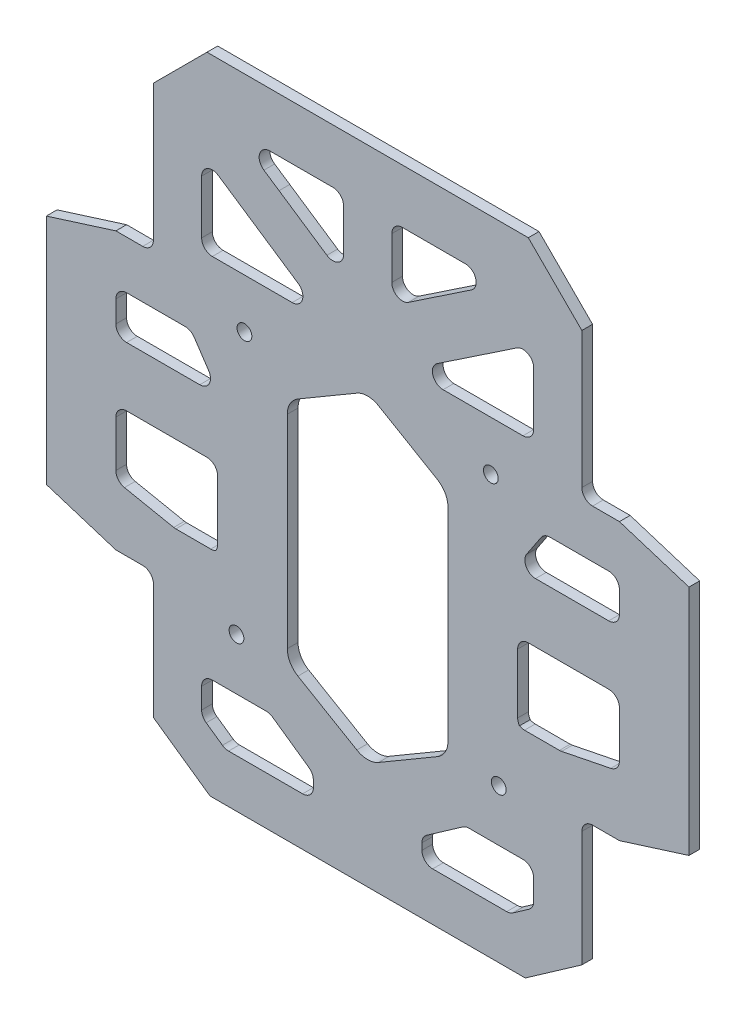
from build123d import *

# Parameters (mm, degrees)
BOSS_EXTRUDE1_DEPTH      = 1.27
CUT_EXTRUDE2_DEPTH       = 118.115761535
CUT_EXTRUDE2_DEPTH_BACK  = 118.115761535
FILLET2_R                = 3.81
FILLET3_R                = 2.54
FILLET5_R                = 5.08
FILLET7_R                = 5.08
FILLET8_R                = 2.54
FILLET10_R               = 2.54
FILLET11_R               = 2.54
CUT_EXTRUDE4_DEPTH       = 118.115761535
CUT_EXTRUDE4_DEPTH_BACK  = 118.115761535
SKETCH3_R                = 1.75
CUT_EXTRUDE5_DEPTH       = 118.115761535
CUT_EXTRUDE5_DEPTH_BACK  = 118.115761535
CUT_EXTRUDE9_DEPTH       = 118.115761535
CUT_EXTRUDE9_DEPTH_BACK  = 118.115761535
SKETCH9_W                = 24.13
SKETCH9_H                = 10.16
BOSS_EXTRUDE4_DEPTH      = 2.54
CUT_EXTRUDE10_DEPTH      = 118.115761535
CUT_EXTRUDE10_DEPTH_BACK = 118.115761535
FILLET12_R               = 2.54
SKETCH12_W               = 24.13
SKETCH12_H               = 3.885775835
BOSS_EXTRUDE5_DEPTH      = 2.54
FILLET13_START           = -1.27
FILLET13_DEPTH           = 2.54
CUT_EXTRUDE11_DEPTH      = 118.115761535
BOSS_EXTRUDE6_DEPTH      = 2.54
BOSS_EXTRUDE7_DEPTH      = 2.54
FILLET15_R               = 2.54
CUT_EXTRUDE12_DEPTH      = 118.115761535
CUT_EXTRUDE13_DEPTH      = 118.115761535
BOSS_EXTRUDE8_DEPTH      = 2.54
SKETCH19_W               = 17.827282033
SKETCH19_H               = 11.43
SKETCH19_W_2             = 11.43
SKETCH19_H_2             = 23.699755781
BOSS_EXTRUDE9_DEPTH      = 2.54
CUT_EXTRUDE14_DEPTH      = 118.115761535
BOSS_EXTRUDE11_DEPTH     = 2.54
BOSS_EXTRUDE13_DEPTH     = 2.54
FILLET16_R               = 2.54
FILLET17_R               = 2.54


with BuildPart() as part:
    # Sketch1 → Boss-Extrude1 (new, symmetric)
    with BuildSketch(Plane.XY):
        Polygon((-76.2, 63.5), (-76.2, -63.5), (76.2, -63.5), (76.2, 63.5), (50.8, 88.9), (-50.8, 88.9), align=None)
    extrude(amount=BOSS_EXTRUDE1_DEPTH, both=True)

    # Sketch2 → Cut-Extrude2 (cut, two sides: drawn at the far end of the back side and taken through both)
    with BuildSketch(Plane.XY.offset(1.27).offset(-CUT_EXTRUDE2_DEPTH_BACK)):
        Polygon((-19.05, 26.9875), (-19.05, -26.9875), (0, -38.14122293), (19.05, -26.9875), (19.05, 26.9875), (0, 38.14122293), align=None)
        Polygon((35.578460557, -11.758335255), (45.548381436, -26.713216576), (59.708460557, -26.713216576), (59.708460557, 27.261783424), (40.076377223, 27.261783424), (35.578460557, 20.514908424), align=None)
        Polygon((59.708460557, -44.311621405), (48.628361261, -52.07), (12.873487357, -52.07), (12.873487357, -46.659917121), (23.222848295, -39.413216576), (59.708460557, -39.413216576), align=None)
        Polygon((76.2, -63.5), (76.2, -57.785), (68.038134141, -63.5), align=None)
        Polygon((9.5434533, 47.581783424), (59.708460557, 47.581783424), (59.708460557, 58.145792392), (46.553776688, 72.39), align=None)
        Polygon((-27.94, 73.66), (27.94, 73.66), (0, 54.931669492), align=None)
        Polygon((-76.2, -57.785), (-68.038134141, -63.5), (-76.2, -63.5), align=None)
        Polygon((-23.222848295, -39.413216576), (-59.708460557, -39.413216576), (-59.708460557, -44.311621405), (-48.628361261, -52.07), (-12.873487357, -52.07), (-12.873487357, -46.659917121), align=None)
        Polygon((-35.578460557, 20.514908424), (-40.076377223, 27.261783424), (-59.708460557, 27.261783424), (-59.708460557, -26.713216576), (-45.548381436, -26.713216576), (-35.578460557, -11.758335255), align=None)
        Polygon((-59.708460557, 58.145792392), (-46.553776688, 72.39), (-9.5434533, 47.581783424), (-59.708460557, 47.581783424), align=None)
    extrude(amount=CUT_EXTRUDE2_DEPTH + CUT_EXTRUDE2_DEPTH_BACK, mode=Mode.SUBTRACT)

    # Fillet2
    fillet2_edges = [part.edges().sort_by_distance(p)[0] for p in [
        (46.553776688, 72.39, 0),
        (59.708460557, 58.145792392, 0),
        (59.708460557, 47.581783424, 0),
        (-59.708460557, 47.581783424, 0),
        (-59.708460557, 58.145792392, 0),
        (-46.553776688, 72.39, 0),
        (0, 54.931669492, 0),
    ]]
    fillet(fillet2_edges, radius=FILLET2_R)

    # Fillet3
    fillet3_edges = [part.edges().sort_by_distance(p)[0] for p in [
        (9.5434533, 47.581783424, 0),
        (-9.5434533, 47.581783424, 0),
        (-27.94, 73.66, 0),
        (27.94, 73.66, 0),
    ]]
    fillet(fillet3_edges, radius=FILLET3_R)

    # Fillet5
    fillet5_edges = [part.edges().sort_by_distance(p)[0] for p in [
        (0, -38.14122293, 0),
        (0, 38.14122293, 0),
    ]]
    fillet(fillet5_edges, radius=FILLET5_R)

    # Fillet7
    fillet7_edges = [part.edges().sort_by_distance(p)[0] for p in [
        (19.05, -26.9875, 0),
        (-19.05, -26.9875, 0),
        (-19.05, 26.9875, 0),
        (19.05, 26.9875, 0),
    ]]
    fillet(fillet7_edges, radius=FILLET7_R)

    # Fillet8
    fillet8_edges = [part.edges().sort_by_distance(p)[0] for p in [
        (12.873487357, -52.07, 0),
        (23.222848295, -39.413216576, 0),
        (59.708460557, -39.413216576, 0),
        (48.628361261, -52.07, 0),
        (-23.222848295, -39.413216576, 0),
        (-12.873487357, -52.07, 0),
        (-48.628361261, -52.07, 0),
        (-59.708460557, -39.413216576, 0),
    ]]
    fillet(fillet8_edges, radius=FILLET8_R)

    # Fillet10
    fillet10_edges = [part.edges().sort_by_distance(p)[0] for p in [
        (12.873487357, -46.659917121, 0),
        (59.708460557, -44.311621405, 0),
        (-12.873487357, -46.659917121, 0),
        (-59.708460557, -44.311621405, 0),
    ]]
    fillet(fillet10_edges, radius=FILLET10_R)

    # Fillet11
    fillet11_edges = [part.edges().sort_by_distance(p)[0] for p in [
        (59.708460557, -26.713216576, 0),
        (45.548381436, -26.713216576, 0),
        (35.578460557, -11.758335255, 0),
        (35.578460557, 20.514908424, 0),
        (40.076377223, 27.261783424, 0),
        (59.708460557, 27.261783424, 0),
        (-35.578460557, 20.514908424, 0),
        (-35.578460557, -11.758335255, 0),
        (-45.548381436, -26.713216576, 0),
        (-59.708460557, -26.713216576, 0),
        (-59.708460557, 27.261783424, 0),
        (-40.076377223, 27.261783424, 0),
    ]]
    fillet(fillet11_edges, radius=FILLET11_R)

    # Sketch3 → Cut-Extrude4 (cut, two sides: drawn at the far end of the back side and taken through both)
    with BuildSketch(Plane(origin=(0, 0, -1.27), x_dir=(-1, 0, 0), z_dir=(0, 0, -1)).offset(-CUT_EXTRUDE4_DEPTH_BACK)):
        with Locations((31.100832091, -27.164313073)):
            Circle(SKETCH3_R)
        with Locations((29.215925728, 35.858350336)):
            Circle(SKETCH3_R)
        with Locations(Location((-31.100832091, -27.164313073, 0), (0, 0, 180))):
            Circle(SKETCH3_R)
        with Locations(Location((-29.215925728, 35.858350336, 0), (0, 0, 180))):
            Circle(SKETCH3_R)
    extrude(amount=CUT_EXTRUDE4_DEPTH + CUT_EXTRUDE4_DEPTH_BACK, mode=Mode.SUBTRACT)

    # Sketch4 → Cut-Extrude5 (cut, two sides: drawn at the far end of the back side and taken through both)
    with BuildSketch(Plane(origin=(0, 0, -1.27), x_dir=(-1, 0, 0), z_dir=(0, 0, -1)).offset(-CUT_EXTRUDE5_DEPTH_BACK)):
        Polygon((-76.2, -52.07), (-76.2, -57.785), (-68.038134141, -63.5), (-59.708460557, -63.5), align=None)
        Polygon((76.2, -52.07), (59.708460557, -63.5), (68.038134141, -63.5), (76.2, -57.785), align=None)
    extrude(amount=CUT_EXTRUDE5_DEPTH + CUT_EXTRUDE5_DEPTH_BACK, mode=Mode.SUBTRACT)

    # Sketch7 → Cut-Extrude9 (cut, two sides: drawn at the far end of the back side and taken through both)
    with BuildSketch(Plane(origin=(0, 0, -1.27), x_dir=(-1, 0, 0), z_dir=(0, 0, -1)).offset(-CUT_EXTRUDE9_DEPTH_BACK)):
        Polygon((59.708460557, 24.721783424), (39.322336222, 26.130721922), (47.469178522, 38.350985376), (59.708460557, 38.350985376), align=None)
        Polygon((-59.708460557, 38.350985376), (-59.708460557, 24.721783424), (-39.322336222, 26.130721922), (-47.469178522, 38.350985376), align=None)
    extrude(amount=CUT_EXTRUDE9_DEPTH + CUT_EXTRUDE9_DEPTH_BACK, mode=Mode.SUBTRACT)

    # Sketch9 → Boss-Extrude4 (add)
    with BuildSketch(Plane(origin=(0, 0, -1.27), x_dir=(-1, 0, 0), z_dir=(0, 0, -1))):
        with Locations((-47.643460557, 14.665858304)):
            Rectangle(SKETCH9_W, SKETCH9_H)
        with Locations((47.643460557, 14.665858304)):
            Rectangle(SKETCH9_W, SKETCH9_H)
    extrude(amount=-BOSS_EXTRUDE4_DEPTH)

    # Sketch11 → Cut-Extrude10 (cut, two sides: drawn at the far end of the back side and taken through both)
    with BuildSketch(Plane(origin=(0, 0, -1.27), x_dir=(-1, 0, 0), z_dir=(0, 0, -1)).offset(-CUT_EXTRUDE10_DEPTH_BACK)):
        Polygon((-21.00307482, 69.010142181), (-31.552363918, 76.081386735), (31.560640268, 76.069023948), (21.00307482, 69.010142181), align=None)
    extrude(amount=CUT_EXTRUDE10_DEPTH + CUT_EXTRUDE10_DEPTH_BACK, mode=Mode.SUBTRACT)

    # Fillet12
    fillet12_edges = [part.edges().sort_by_distance(p)[0] for p in [
        (31.552363918, 76.081386735, 0),
        (-31.560640268, 76.069023948, 0),
    ]]
    fillet(fillet12_edges, radius=FILLET12_R)

    # Sketch12 → Boss-Extrude5 (add)
    with BuildSketch(Plane(origin=(0, 0, -1.27), x_dir=(-1, 0, 0), z_dir=(0, 0, -1))):
        with Locations((47.643460557, 7.642970387)):
            Rectangle(SKETCH12_W, SKETCH12_H)
        with Locations((-47.643460557, 7.642970387)):
            Rectangle(SKETCH12_W, SKETCH12_H)
    extrude(amount=-BOSS_EXTRUDE5_DEPTH)

    # Fillet13: read off the stored shape, not the designer's step
    # Fillet13 outline → Fillet13 (add)
    with BuildSketch(Plane.XY.offset(FILLET13_START)):
        with BuildLine():
            ThreePointArc((57.168460557, 38.350985376), (58.964511781, 37.6070366), (59.708460557, 35.810985376))
            Line((59.708460557, 35.810985376), (59.708460557, 38.350985376))
            Line((59.708460557, 38.350985376), (57.168460557, 38.350985376))
        make_face()
        with BuildLine():
            Line((59.708460557, 19.745858304), (59.708460557, 22.285858304))
            ThreePointArc((59.708460557, 22.285858304), (58.964511781, 20.48980708), (57.168460557, 19.745858304))
            Line((57.168460557, 19.745858304), (59.708460557, 19.745858304))
        make_face()
        with BuildLine():
            ThreePointArc((46.715137521, 37.219923874), (47.630026138, 38.050438857), (48.828545269, 38.350985376))
            Line((48.828545269, 38.350985376), (47.469178522, 38.350985376))
            Line((47.469178522, 38.350985376), (46.715137521, 37.219923874))
        make_face()
        with BuildLine():
            Line((35.578460557, 19.745858304), (39.81179389, 19.745858304))
            ThreePointArc((39.81179389, 19.745858304), (37.572340409, 21.087339173), (37.698386142, 23.694796802))
            Line((37.698386142, 23.694796802), (36.005052809, 21.154796802))
            ThreePointArc((36.005052809, 21.154796802), (35.68744681, 20.481910041), (35.578460557, 19.745858304))
        make_face()
        with BuildLine():
            Line((59.708460557, 5.700082469), (57.168460557, 5.700082469))
            ThreePointArc((57.168460557, 5.700082469), (58.964511781, 4.956133693), (59.708460557, 3.160082469))
            Line((59.708460557, 3.160082469), (59.708460557, 5.700082469))
        make_face()
        with BuildLine():
            ThreePointArc((35.578460557, 3.160082469), (36.322409333, 4.956133693), (38.118460557, 5.700082469))
            Line((38.118460557, 5.700082469), (35.578460557, 5.700082469))
            Line((35.578460557, 5.700082469), (35.578460557, 3.160082469))
        make_face()
        with BuildLine():
            Line((-59.708460557, 38.350985376), (-59.708460557, 35.810985376))
            ThreePointArc((-59.708460557, 35.810985376), (-58.964511781, 37.6070366), (-57.168460557, 38.350985376))
            Line((-57.168460557, 38.350985376), (-59.708460557, 38.350985376))
        make_face()
        with BuildLine():
            ThreePointArc((-57.168460557, 19.745858304), (-58.964511781, 20.48980708), (-59.708460557, 22.285858304))
            Line((-59.708460557, 22.285858304), (-59.708460557, 19.745858304))
            Line((-59.708460557, 19.745858304), (-57.168460557, 19.745858304))
        make_face()
        with BuildLine():
            Line((-47.469178522, 38.350985376), (-48.828545269, 38.350985376))
            ThreePointArc((-48.828545269, 38.350985376), (-47.630026138, 38.050438857), (-46.715137521, 37.219923874))
            Line((-46.715137521, 37.219923874), (-47.469178522, 38.350985376))
        make_face()
        with BuildLine():
            ThreePointArc((-37.698386142, 23.694796802), (-37.572340409, 21.087339173), (-39.81179389, 19.745858304))
            Line((-39.81179389, 19.745858304), (-35.578460557, 19.745858304))
            ThreePointArc((-35.578460557, 19.745858304), (-35.68744681, 20.481910041), (-36.005052809, 21.154796802))
            Line((-36.005052809, 21.154796802), (-37.698386142, 23.694796802))
        make_face()
        with BuildLine():
            Line((-59.708460557, 5.700082469), (-59.708460557, 3.160082469))
            ThreePointArc((-59.708460557, 3.160082469), (-58.964511781, 4.956133693), (-57.168460557, 5.700082469))
            Line((-57.168460557, 5.700082469), (-59.708460557, 5.700082469))
        make_face()
        with BuildLine():
            Line((-35.578460557, 5.700082469), (-38.118460557, 5.700082469))
            ThreePointArc((-38.118460557, 5.700082469), (-36.322409333, 4.956133693), (-35.578460557, 3.160082469))
            Line((-35.578460557, 3.160082469), (-35.578460557, 5.700082469))
        make_face()
    extrude(amount=FILLET13_DEPTH)

    # Sketch13 → Cut-Extrude11 (cut, through all)
    with BuildSketch(Plane(origin=(0, 0, -1.27), x_dir=(-1, 0, 0), z_dir=(0, 0, -1))):
        Polygon((-50.8, 88.9), (-50.8, 38.350985376), (-76.2, 38.350985376), (-76.2, 63.5), align=None)
        Polygon((50.8, 88.9), (76.2, 63.5), (76.2, 38.350985376), (50.8, 38.350985376), align=None)
        Polygon((-50.8, -63.5), (-50.8, -12.950985274), (-76.2, -12.950985274), (-76.2, -52.07), (-59.708460557, -63.5), align=None)
        Polygon((76.2, -52.07), (59.708460557, -63.5), (50.8, -63.5), (50.8, -12.950985274), (76.2, -12.950985274), align=None)
    extrude(amount=-CUT_EXTRUDE11_DEPTH, mode=Mode.SUBTRACT)

    # Sketch14 → Boss-Extrude6 (add)
    with BuildSketch(Plane(origin=(0, 0, -1.27), x_dir=(-1, 0, 0), z_dir=(0, 0, -1))):
        Polygon((-43.810489913, -39.413216576), (-50.8, -39.413216576), (-50.8, -52.07), (-43.810489913, -52.07), (-43.810489913, -45.043392375), align=None)
        Polygon((-33.775454239, -52.07), (-43.810489913, -45.043392375), (-43.810489913, -52.07), align=None)
        Polygon((43.810489913, -45.043392375), (43.810489913, -52.07), (50.8, -52.07), (50.8, -39.413216576), (43.810489913, -39.413216576), align=None)
        Polygon((33.775454239, -52.07), (43.810489913, -52.07), (43.810489913, -45.043392375), align=None)
    extrude(amount=-BOSS_EXTRUDE6_DEPTH)

    # Sketch15 → Boss-Extrude7 (add)
    with BuildSketch(Plane(origin=(0, 0, -1.27), x_dir=(-1, 0, 0), z_dir=(0, 0, -1))):
        Polygon((-39.37, -39.413216576), (-39.37, -48.152656885), (-43.810489913, -45.043392375), (-43.810489913, -39.413216576), align=None)
        Polygon((43.810489913, -39.413216576), (43.810489913, -45.043392375), (39.37, -48.152656885), (39.37, -39.413216576), align=None)
    extrude(amount=-BOSS_EXTRUDE7_DEPTH)

    # Fillet15
    fillet15_edges = [part.edges().sort_by_distance(p)[0] for p in [
        (-33.775454239, -52.07, 0),
        (33.775454239, -52.07, 0),
        (39.37, -48.152656885, 0),
        (39.37, -39.413216576, 0),
        (-39.37, -48.152656885, 0),
        (-39.37, -39.413216576, 0),
    ]]
    fillet(fillet15_edges, radius=FILLET15_R)

    # Sketch16 → Cut-Extrude12 (cut, through all)
    with BuildSketch(Plane(origin=(0, 0, -1.27), x_dir=(-1, 0, 0), z_dir=(0, 0, -1))):
        Polygon((50.8, -54.102738273), (37.379319396, -63.5), (50.8, -63.5), align=None)
        Polygon((-50.8, -54.102738273), (-50.8, -63.5), (-37.379319396, -63.5), align=None)
    extrude(amount=-CUT_EXTRUDE12_DEPTH, mode=Mode.SUBTRACT)

    # Sketch17 → Cut-Extrude13 (cut, through all)
    with BuildSketch(Plane(origin=(0, 0, -1.27), x_dir=(-1, 0, 0), z_dir=(0, 0, -1))):
        Polygon((-76.2, -7.751222861), (-59.708460557, -12.950985274), (-76.2, -12.950985274), align=None)
        Polygon((76.2, -7.751222861), (76.2, -12.950985274), (59.708460557, -12.950985274), align=None)
        Polygon((76.2, 33.151222963), (59.708460557, 38.350985376), (76.2, 38.350985376), align=None)
        Polygon((-76.2, 33.151222963), (-76.2, 38.350985376), (-59.708460557, 38.350985376), align=None)
    extrude(amount=-CUT_EXTRUDE13_DEPTH, mode=Mode.SUBTRACT)

    # Sketch18 → Boss-Extrude8 (add)
    with BuildSketch(Plane(origin=(0, 0, -1.27), x_dir=(-1, 0, 0), z_dir=(0, 0, -1))):
        Polygon((-59.708460557, -12.950985274), (-59.708460557, -24.126985274), (-76.2, -18.927222861), (-76.2, -7.751222861), align=None)
        Polygon((-59.708460557, 38.350985376), (-59.708460557, 41.398985376), (-76.2, 36.199222963), (-76.2, 33.151222963), align=None)
        Polygon((76.2, -7.751222861), (76.2, -18.927222861), (59.708460557, -24.126985274), (59.708460557, -12.950985274), align=None)
        Polygon((59.708460557, 38.350985376), (59.708460557, 41.398985376), (76.2, 36.199222963), (76.2, 33.151222963), align=None)
    extrude(amount=-BOSS_EXTRUDE8_DEPTH)

    # Sketch19 → Boss-Extrude9 (add)
    with BuildSketch(Plane(origin=(0, 0, -1.27), x_dir=(-1, 0, 0), z_dir=(0, 0, -1))):
        Polygon((-59.708460557, -24.126985274), (-50.8, -24.126985274), (-50.8, -26.713216576), (-36.204227236, -26.713216576), (-36.204227236, -12.696985274), (-59.708460557, -12.696985274), align=None)
        with Locations((-50.794819541, 35.683985376)):
            Rectangle(SKETCH19_W, SKETCH19_H)
        with Locations((-45.085, 59.431661315)):
            Rectangle(SKETCH19_W_2, SKETCH19_H_2)
        Polygon((36.204227236, -12.696985274), (36.204227236, -26.713216576), (50.8, -26.713216576), (50.8, -24.126985274), (59.708460557, -24.126985274), (59.708460557, -12.696985274), align=None)
        with Locations((50.794819541, 35.683985376)):
            Rectangle(SKETCH19_W, SKETCH19_H)
        with Locations((45.085, 59.431661315)):
            Rectangle(SKETCH19_W_2, SKETCH19_H_2)
    extrude(amount=-BOSS_EXTRUDE9_DEPTH)

    # Sketch20 → Cut-Extrude14 (cut, through all)
    with BuildSketch(Plane(origin=(0, 0, -1.27), x_dir=(-1, 0, 0), z_dir=(0, 0, -1))):
        Polygon((50.8, 88.9), (50.8, 76.2), (38.1, 88.9), align=None)
        Polygon((-50.8, 88.9), (-50.8, 76.2), (-38.1, 88.9), align=None)
    extrude(amount=-CUT_EXTRUDE14_DEPTH, mode=Mode.SUBTRACT)

    # Sketch21 → Boss-Extrude11 (add)
    with BuildSketch(Plane(origin=(0, 0, -1.27), x_dir=(-1, 0, 0), z_dir=(0, 0, -1))):
        Polygon((-5.716720007, 54.486325962), (5.713279773, 54.486325962), (5.713279773, 76.074087016), (-5.716720007, 76.076325962), align=None)
    extrude(amount=-BOSS_EXTRUDE11_DEPTH)

    # Sketch22 → Boss-Extrude13 (add)
    with BuildSketch(Plane(origin=(0, 0, -1.27), x_dir=(-1, 0, 0), z_dir=(0, 0, -1))):
        Polygon((-45.738460557, -12.696985274), (-59.708460557, -9.88815845), (-59.708460557, -12.696985274), align=None)
        Polygon((59.708460557, -9.88815845), (59.708460557, -12.696985274), (45.738460557, -12.696985274), align=None)
    extrude(amount=-BOSS_EXTRUDE13_DEPTH)

    # Fillet16
    # the kernel refuses this fillet: 2.54 mm, written as the material it adds along each edge
    with BuildSketch(Plane(origin=(36.204227236, -12.696985274, -1.27), x_dir=(1, 0, 0), z_dir=(0, 0, 1))) as fillet16_piece_1:
        with BuildLine():
            CenterArc((0.996003642, 2.54), FILLET16_R, 241.930479822, 28.069520178)
            Line((-0.199174427, 0.29876164), (-0.223077988, 0.253936873))
            ThreePointArc((-0.223077988, 0.253936873), (-0.141855368, 0.12120205), (-0.042268155, -0.02817877))
            Line((-0.042268155, -0.02817877), (0, -0.0508))
            Line((0, -0.0508), (0.996003642, -0.0508))
            Line((0.996003642, -0.0508), (0.996003642, 0))
        make_face()
    extrude(amount=2.54)
    with BuildSketch(Plane(origin=(-36.204227236, -12.696985274, -1.27), x_dir=(0.5547001961529444, 0.8320502943860334, 0), z_dir=(0, 0, 1))) as fillet16_piece_2:
        with BuildLine():
            CenterArc((1.560924332, 2.237663621), FILLET16_R, 213.690067521, 28.069520178)
            Line((-0.552483415, 0.828725123), (-0.59475157, 0.800546353))
            Line((-0.59475157, 0.800546353), (-0.042268155, -0.02817877))
            Line((-0.042268155, -0.02817877), (0, -0.0508))
            ThreePointArc((0, -0.0508), (0.179533402, -0.0508), (0.335029654, -0.044753272))
            Line((0.335029654, -0.044753272), (0.359066805, 0))
        make_face()
    extrude(amount=2.54)
    with BuildSketch(Plane(origin=(-59.708460557, -9.88815845, -1.27), x_dir=(0, 1, 0), z_dir=(0, 0, 1))) as fillet16_piece_3:
        with BuildLine():
            CenterArc((FILLET16_R * 0.818951245037, -FILLET16_R), FILLET16_R, 90, 78.63160841)
            Line((-FILLET16_R * 0.161428822198, -FILLET16_R * 0.802883476671), (-FILLET16_R * 0.181036423542, -FILLET16_R * 0.798941146205))
            Line((-FILLET16_R * 0.181036423542, -FILLET16_R * 0.798941146205), (-FILLET16_R * 0.0163790249007, FILLET16_R * 0.02))
            Line((-FILLET16_R * 0.0163790249007, FILLET16_R * 0.02), (FILLET16_R * 0.818951245037, FILLET16_R * 0.02))
            Line((FILLET16_R * 0.818951245037, FILLET16_R * 0.02), (FILLET16_R * 0.818951245037, 0))
        make_face()
    extrude(amount=2.54)
    with BuildSketch(Plane(origin=(-45.738460557, -12.696985274, -1.27), x_dir=(1, 0, 0), z_dir=(0, 0, 1))) as fillet16_piece_4:
        with BuildLine():
            CenterArc((FILLET16_R * 0.0995346936631, FILLET16_R), FILLET16_R, 258.63160841, 11.36839159)
            Line((-FILLET16_R * 0.0975818296657, FILLET16_R * 0.0196199327655), (-FILLET16_R * 0.101524160132, FILLET16_R * 1.23314207901e-05))
            Line((-FILLET16_R * 0.101524160132, FILLET16_R * 1.23314207901e-05), (-FILLET16_R * 0.00199069387326, -FILLET16_R * 0.02))
            Line((-FILLET16_R * 0.00199069387326, -FILLET16_R * 0.02), (FILLET16_R * 0.0995346936632, -FILLET16_R * 0.02))
            Line((FILLET16_R * 0.0995346936632, -FILLET16_R * 0.02), (FILLET16_R * 0.0995346936632, 0))
        make_face()
    extrude(amount=2.54)
    with BuildSketch(Plane(origin=(-59.708460557, 29.968985376, -1.27), x_dir=(0, -1, 0), z_dir=(0, 0, 1)), Plane(origin=(-39.37, 47.581783424, -1.27), x_dir=(1, 0, 0), z_dir=(0, 0, 1)), Plane(origin=(59.708460557, 29.968985376, -1.27), x_dir=(-1, 0, 0), z_dir=(0, 0, 1)), Plane(origin=(39.37, 47.581783424, -1.27), x_dir=(0, 1, 0), z_dir=(0, 0, 1))) as fillet16_piece_5:
        with BuildLine():
            CenterArc((FILLET16_R, FILLET16_R), FILLET16_R, 180, 90)
            Line((0, FILLET16_R), (-FILLET16_R * 0.02, FILLET16_R))
            Line((-FILLET16_R * 0.02, FILLET16_R), (-FILLET16_R * 0.02, -FILLET16_R * 0.02))
            Line((-FILLET16_R * 0.02, -FILLET16_R * 0.02), (FILLET16_R, -FILLET16_R * 0.02))
            Line((FILLET16_R, -FILLET16_R * 0.02), (FILLET16_R, 0))
        make_face()
    extrude(amount=2.54)
    with BuildSketch(Plane(origin=(-41.881178524, 29.968985376, -1.27), x_dir=(-1, 0, 0), z_dir=(0, 0, 1)), Plane(origin=(41.881178524, 29.968985376, -1.27), x_dir=(-0.5547001961529443, -0.8320502943860335, 0), z_dir=(0, 0, 1))) as fillet16_piece_6:
        with BuildLine():
            CenterArc((FILLET16_R * 0.535183758544, FILLET16_R), FILLET16_R, 213.690067521, 56.309932479)
            Line((-FILLET16_R * 0.296866535842, FILLET16_R * 0.445299803847), (-FILLET16_R * 0.31350754173, FILLET16_R * 0.434205799924))
            Line((-FILLET16_R * 0.31350754173, FILLET16_R * 0.434205799924), (-FILLET16_R * 0.0107036751709, -FILLET16_R * 0.02))
            Line((-FILLET16_R * 0.0107036751709, -FILLET16_R * 0.02), (FILLET16_R * 0.535183758544, -FILLET16_R * 0.02))
            Line((FILLET16_R * 0.535183758544, -FILLET16_R * 0.02), (FILLET16_R * 0.535183758544, 0))
        make_face()
    extrude(amount=2.54)
    with BuildSketch(Plane(origin=(5.716720007, 76.076325962, -1.27), x_dir=(0, -1, 0), z_dir=(0, 0, 1))) as fillet16_piece_7:
        with BuildLine():
            CenterArc((FILLET16_R * 0.999804135845, FILLET16_R), FILLET16_R, 180.011223289, 89.988776711)
            Line((-FILLET16_R * 0.000195844970091, FILLET16_R * 0.999804116663), (-FILLET16_R * 0.0201958445864, FILLET16_R * 0.999800198997))
            Line((-FILLET16_R * 0.0201958445864, FILLET16_R * 0.999800198997), (-FILLET16_R * 0.0199960827169, -FILLET16_R * 0.02))
            Line((-FILLET16_R * 0.0199960827169, -FILLET16_R * 0.02), (FILLET16_R * 0.999804135845, -FILLET16_R * 0.02))
            Line((FILLET16_R * 0.999804135845, -FILLET16_R * 0.02), (FILLET16_R * 0.999804135845, 0))
        make_face()
    extrude(amount=2.54)
    with BuildSketch(Plane(origin=(5.716720007, 58.763617299, -1.27), x_dir=(0.8306526848227322, 0.5567909097648657, 0), z_dir=(0, 0, 1))) as fillet16_piece_8:
        with BuildLine():
            CenterArc((FILLET16_R * 1.87417790637, FILLET16_R), FILLET16_R, 146.165843, 123.834157)
            Line((FILLET16_R * 1.04352522155, FILLET16_R * 1.55679090976), (FILLET16_R * 1.02691216785, FILLET16_R * 1.56792672796))
            Line((FILLET16_R * 1.02691216785, FILLET16_R * 1.56792672796), (-FILLET16_R * 0.0166130536965, FILLET16_R * 0.0111358181953))
            Line((-FILLET16_R * 0.0166130536965, FILLET16_R * 0.0111358181953), (0, -FILLET16_R * 0.02))
            Line((0, -FILLET16_R * 0.02), (FILLET16_R * 1.87417790637, -FILLET16_R * 0.02))
            Line((FILLET16_R * 1.87417790637, -FILLET16_R * 0.02), (FILLET16_R * 1.87417790637, 0))
        make_face()
    extrude(amount=2.54)
    with BuildSketch(Plane(origin=(-5.713279773, 76.074087016, -1.27), x_dir=(-0.999999980814859, -0.00019588333660196908, 0), z_dir=(0, 0, 1))) as fillet16_piece_9:
        with BuildLine():
            CenterArc((FILLET16_R * 1.00019590253, FILLET16_R), FILLET16_R, 179.988776711, 90.011223289)
            Line((FILLET16_R * 0.000195921710644, FILLET16_R * 1.00019588334), (-FILLET16_R * 0.0198040779057, FILLET16_R * 1.000199801))
            Line((-FILLET16_R * 0.0198040779057, FILLET16_R * 1.000199801), (-FILLET16_R * 0.0200039180505, -FILLET16_R * 0.02))
            Line((-FILLET16_R * 0.0200039180505, -FILLET16_R * 0.02), (FILLET16_R * 1.00019590253, -FILLET16_R * 0.02))
            Line((FILLET16_R * 1.00019590253, -FILLET16_R * 0.02), (FILLET16_R * 1.00019590253, 0))
        make_face()
    extrude(amount=2.54)
    with BuildSketch(Plane(origin=(-5.713279773, 58.761311292, 1.27), x_dir=(0, 1, 0), z_dir=(0, 0, -1))) as fillet16_piece_10:
        with BuildLine():
            CenterArc((FILLET16_R * 1.87417790637, -FILLET16_R), FILLET16_R, 90, 123.834157)
            Line((FILLET16_R * 1.04352522155, -FILLET16_R * 1.55679090976), (FILLET16_R * 1.02691216785, -FILLET16_R * 1.56792672796))
            Line((FILLET16_R * 1.02691216785, -FILLET16_R * 1.56792672796), (-FILLET16_R * 0.0166130536965, -FILLET16_R * 0.0111358181953))
            Line((-FILLET16_R * 0.0166130536965, -FILLET16_R * 0.0111358181953), (0, FILLET16_R * 0.02))
            Line((0, FILLET16_R * 0.02), (FILLET16_R * 1.87417790637, FILLET16_R * 0.02))
            Line((FILLET16_R * 1.87417790637, FILLET16_R * 0.02), (FILLET16_R * 1.87417790637, 0))
        make_face()
    extrude(amount=2.54)
    with BuildSketch(Plane(origin=(-39.37, 67.574676285, 1.27), x_dir=(0, -1, 0), z_dir=(0, 0, -1))) as fillet16_piece_11:
        with BuildLine():
            CenterArc((FILLET16_R * 1.87417791016, -FILLET16_R), FILLET16_R, 90, 123.834157096)
            Line((FILLET16_R * 1.04352522627, -FILLET16_R * 1.55679091116), (FILLET16_R * 1.02691217259, -FILLET16_R * 1.56792672938))
            Line((FILLET16_R * 1.02691217259, -FILLET16_R * 1.56792672938), (-FILLET16_R * 0.0166130536778, -FILLET16_R * 0.0111358182232))
            Line((-FILLET16_R * 0.0166130536778, -FILLET16_R * 0.0111358182232), (0, FILLET16_R * 0.02))
            Line((0, FILLET16_R * 0.02), (FILLET16_R * 1.87417791016, FILLET16_R * 0.02))
            Line((FILLET16_R * 1.87417791016, FILLET16_R * 0.02), (FILLET16_R * 1.87417791016, 0))
        make_face()
    extrude(amount=2.54)
    with BuildSketch(Plane(origin=(45.738460557, -12.696985274, -1.27), x_dir=(-1, 0, 0), z_dir=(0, 0, 1))) as fillet16_piece_12:
        with BuildLine():
            CenterArc((FILLET16_R * 0.0995346936632, -FILLET16_R), FILLET16_R, 90, 11.36839159)
            Line((-FILLET16_R * 0.0975818296657, -FILLET16_R * 0.0196199327655), (-FILLET16_R * 0.101524160132, -FILLET16_R * 1.23314207986e-05))
            Line((-FILLET16_R * 0.101524160132, -FILLET16_R * 1.23314207986e-05), (-FILLET16_R * 0.00199069387326, FILLET16_R * 0.02))
            Line((-FILLET16_R * 0.00199069387326, FILLET16_R * 0.02), (FILLET16_R * 0.0995346936632, FILLET16_R * 0.02))
            Line((FILLET16_R * 0.0995346936632, FILLET16_R * 0.02), (FILLET16_R * 0.0995346936632, 0))
        make_face()
    extrude(amount=2.54)
    with BuildSketch(Plane(origin=(59.708460557, -9.88815845, -1.27), x_dir=(0, 1, 0), z_dir=(0, 0, 1))) as fillet16_piece_13:
        with BuildLine():
            CenterArc((FILLET16_R * 0.818951245037, FILLET16_R), FILLET16_R, 191.36839159, 78.63160841)
            Line((-FILLET16_R * 0.161428822198, FILLET16_R * 0.802883476671), (-FILLET16_R * 0.181036423542, FILLET16_R * 0.798941146205))
            Line((-FILLET16_R * 0.181036423542, FILLET16_R * 0.798941146205), (-FILLET16_R * 0.0163790249007, -FILLET16_R * 0.02))
            Line((-FILLET16_R * 0.0163790249007, -FILLET16_R * 0.02), (FILLET16_R * 0.818951245037, -FILLET16_R * 0.02))
            Line((FILLET16_R * 0.818951245037, -FILLET16_R * 0.02), (FILLET16_R * 0.818951245037, 0))
        make_face()
    extrude(amount=2.54)
    with BuildSketch(Plane(origin=(39.37, 67.574676285, 1.27), x_dir=(0, -1, 0), z_dir=(0, 0, -1))) as fillet16_piece_14:
        with BuildLine():
            CenterArc((FILLET16_R * 1.87417791016, FILLET16_R), FILLET16_R, 146.165842904, 123.834157096)
            Line((FILLET16_R * 1.04352522627, FILLET16_R * 1.55679091116), (FILLET16_R * 1.02691217259, FILLET16_R * 1.56792672938))
            Line((FILLET16_R * 1.02691217259, FILLET16_R * 1.56792672938), (-FILLET16_R * 0.0166130536778, FILLET16_R * 0.0111358182232))
            Line((-FILLET16_R * 0.0166130536778, FILLET16_R * 0.0111358182232), (0, -FILLET16_R * 0.02))
            Line((0, -FILLET16_R * 0.02), (FILLET16_R * 1.87417791016, -FILLET16_R * 0.02))
            Line((FILLET16_R * 1.87417791016, -FILLET16_R * 0.02), (FILLET16_R * 1.87417791016, 0))
        make_face()
    extrude(amount=2.54)

    # Fillet17
    fillet17_edges = [part.edges().sort_by_distance(p)[0] for p in [
        (-50.8, -24.126985274, 0),
        (-50.8, 41.398985376, 0),
        (50.8, 41.398985376, 0),
        (50.8, -24.126985274, 0),
    ]]
    fillet(fillet17_edges, radius=FILLET17_R)


solid = part.part
